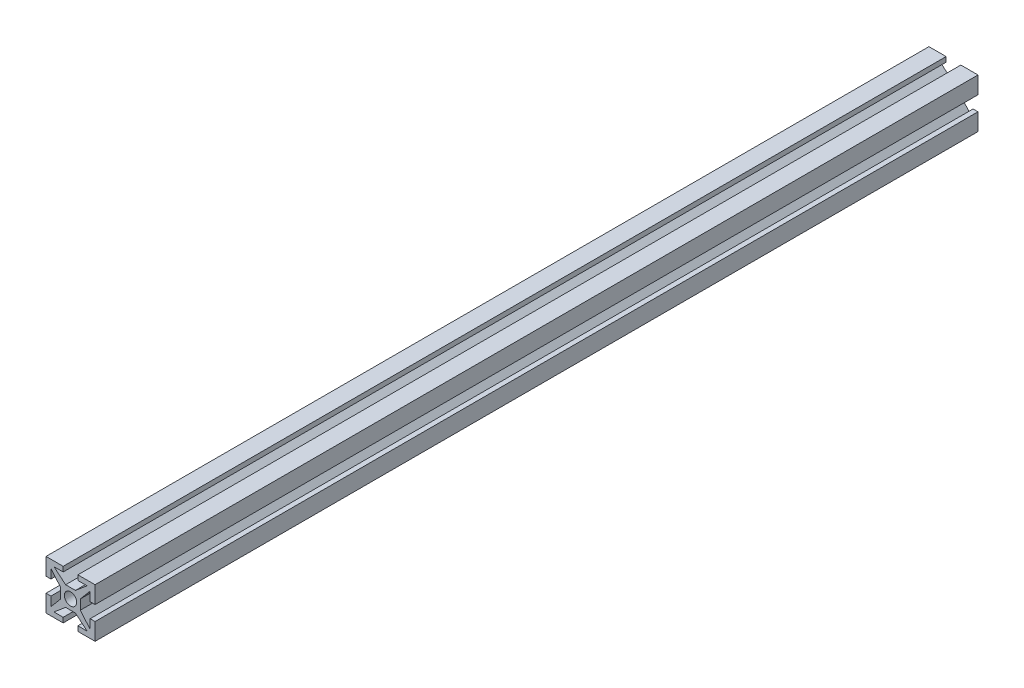
from build123d import *

# Parameters (mm, degrees)
ESQUISSE2_R          = 1.25
MAIN_EXTRUSION_DEPTH = 180


with BuildPart() as part:
    # Esquisse2 → Main Extrusion (new body)
    with BuildSketch(Plane.XY):
        Polygon((-1, -2), (1, -2), (3.383507185, -4), (1.5, -4), (1.5, -5), (5, -5), (5, -1.5), (4, -1.5), (4, -3.383507185), (2, -1), (2, 1), (4, 3.383507185), (4, 1.5), (5, 1.5), (5, 5), (1.5, 5), (1.5, 4), (3.383507185, 4), (1, 2), (-1, 2), (-3.383507185, 4), (-1.5, 4), (-1.5, 5), (-5, 5), (-5, 1.5), (-4, 1.5), (-4, 3.383507185), (-2, 1), (-2, -1), (-4, -3.383507185), (-4, -1.5), (-5, -1.5), (-5, -5), (-1.5, -5), (-1.5, -4), (-3.383507185, -4), align=None)
        Circle(ESQUISSE2_R, mode=Mode.SUBTRACT)
    extrude(amount=MAIN_EXTRUSION_DEPTH)


solid = part.part
